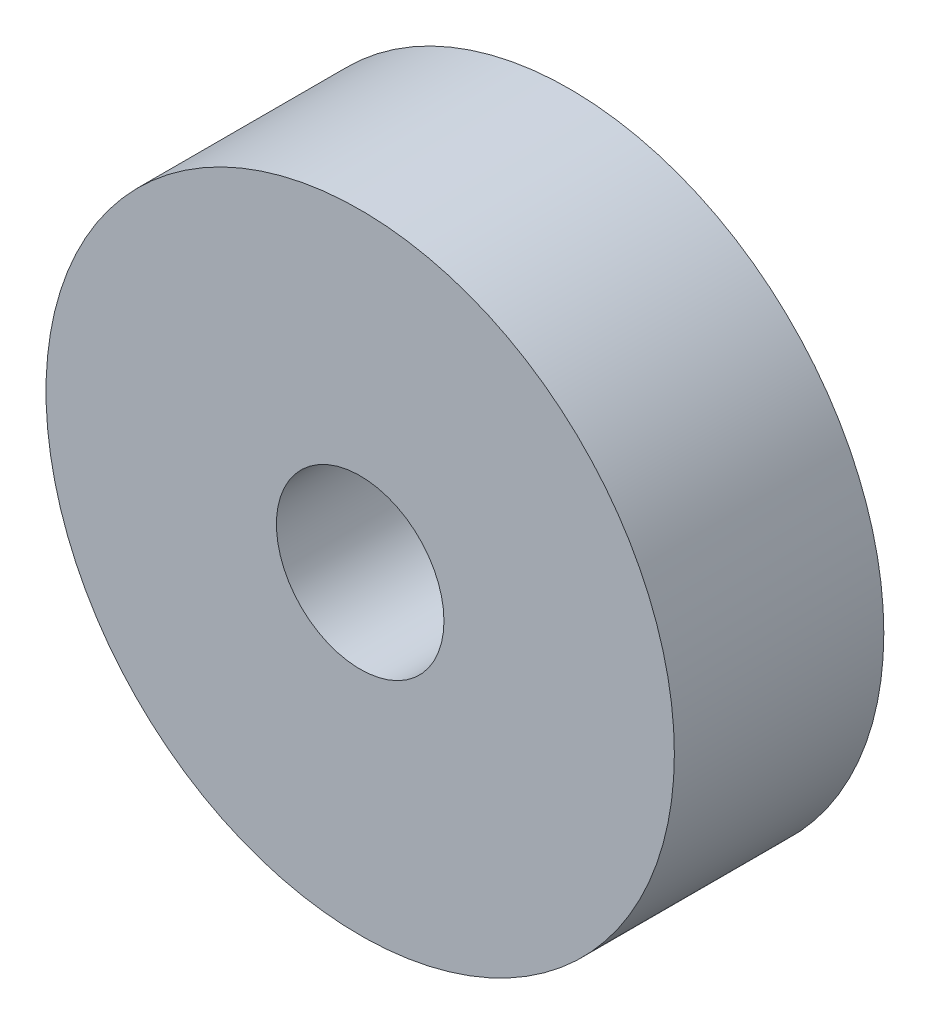
from build123d import *

# Parameters (mm, degrees)
SKETCH1_R           = 15
SKETCH1_R_2         = 4
BOSS_EXTRUDE1_DEPTH = 10


with BuildPart() as part:
    # Sketch1 → Boss-Extrude1 (new body)
    with BuildSketch(Plane.XY):
        Circle(SKETCH1_R)
        Circle(SKETCH1_R_2, mode=Mode.SUBTRACT)
    extrude(amount=BOSS_EXTRUDE1_DEPTH)


solid = part.part
